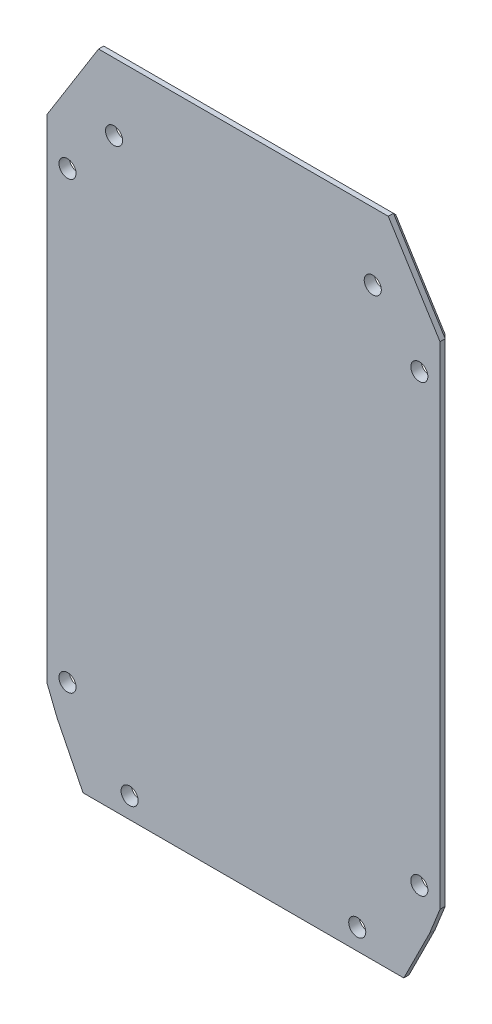
from build123d import *

# Parameters (mm, degrees)
SKETCH_3_R        = 1.65
EXTRUDE_242_DEPTH = 2
CHAMFER_C1_SIZE   = 1


with BuildPart() as part:
    # 草图3 → Extrude 242 (new body)
    with BuildSketch(Plane.XY):
        Polygon((-31, -60), (31, -60), (36, -50), (38, -45), (38, 50), (28, 66), (-28, 66), (-38, 50), (-38, -45), (-36, -50), align=None)
        with Locations((-22, -56)):
            Circle(SKETCH_3_R, mode=Mode.SUBTRACT)
        with Locations((-25, 53)):
            Circle(SKETCH_3_R, mode=Mode.SUBTRACT)
        with Locations((-34, -43)):
            Circle(SKETCH_3_R, mode=Mode.SUBTRACT)
        with Locations((-34, 43)):
            Circle(SKETCH_3_R, mode=Mode.SUBTRACT)
        with Locations((22, -56)):
            Circle(SKETCH_3_R, mode=Mode.SUBTRACT)
        with Locations((25, 53)):
            Circle(SKETCH_3_R, mode=Mode.SUBTRACT)
        with Locations((34, -43)):
            Circle(SKETCH_3_R, mode=Mode.SUBTRACT)
        with Locations((34, 43)):
            Circle(SKETCH_3_R, mode=Mode.SUBTRACT)
    extrude(amount=EXTRUDE_242_DEPTH)

    # 底盖全周向心倒角_C1
    # the kernel refuses this chamfer: 1 mm, written as the material it takes off along each edge
    with BuildSketch(Plane(origin=(-38.955099084, -42.612252289, 0), x_dir=(-0.02552928052838921, -0.010211712211355682, 0.9996219169112968), z_dir=(0.3713906763541037, -0.9284766908852594, 0)), Plane(origin=(35.044900916, -52.387747711, 0), x_dir=(0.025529280528384445, -0.010211712211353776, 0.9996219169112968), z_dir=(0.3713906763541037, 0.9284766908852594, 0))) as chamfer_c1_piece_1:
        Polygon((CHAMFER_C1_SIZE * 0.999621916911, -CHAMFER_C1_SIZE * 0.0274958766106), (-CHAMFER_C1_SIZE * 0.0274958766106, -CHAMFER_C1_SIZE * 0.999621916911), (0, 0), align=None)
    extrude(amount=10.528530783, mode=Mode.SUBTRACT)
    with BuildSketch(Plane(origin=(-38, 52.571682988, 0), x_dir=(-0.02749587661058908, 0, 0.9996219169112968), z_dir=(0, -1, 0)), Plane(origin=(38, -47.571682988, 0), x_dir=(0.02749587661058908, 0, 0.9996219169112968), z_dir=(0, 1, 0))) as chamfer_c1_piece_2:
        Polygon((CHAMFER_C1_SIZE * 0.999621916911, -CHAMFER_C1_SIZE * 0.0274958766106), (-CHAMFER_C1_SIZE * 0.0274958766106, -CHAMFER_C1_SIZE * 0.999621916911), (0, 0), align=None)
    extrude(amount=100.143365976, mode=Mode.SUBTRACT)
    with BuildSketch(Plane(origin=(-26.637010742, 68.180782812, 0), x_dir=(-0.023316456732911925, 0.014572785458069957, 0.9996219169112968), z_dir=(-0.52999894000318, -0.847998304005088, 0)), Plane(origin=(39.362989258, 47.819217188, 0), x_dir=(0.023316456732909444, 0.014572785458068402, 0.9996219169112968), z_dir=(-0.52999894000318, 0.847998304005088, 0))) as chamfer_c1_piece_3:
        Polygon((CHAMFER_C1_SIZE * 0.999621916911, -CHAMFER_C1_SIZE * 0.0274958766106), (-CHAMFER_C1_SIZE * 0.0274958766106, -CHAMFER_C1_SIZE * 0.999621916911), (0, 0), align=None)
    extrude(amount=24.01132824, mode=Mode.SUBTRACT)
    with BuildSketch(Plane(origin=(30.571682988, 66, 0), x_dir=(0, 0.027495876610582174, 0.9996219169112968), z_dir=(-1, 0, 0))) as chamfer_c1_piece_4:
        Polygon((CHAMFER_C1_SIZE * 0.999621916911, -CHAMFER_C1_SIZE * 0.0274958766106), (-CHAMFER_C1_SIZE * 0.0274958766106, -CHAMFER_C1_SIZE * 0.999621916911), (0, 0), align=None)
    extrude(amount=61.143365976, mode=Mode.SUBTRACT)
    with BuildSketch(Plane(origin=(29.849908404, -62.300183191, 0), x_dir=(0.02459305968088644, -0.01229652984044322, 0.9996219169112968), z_dir=(0.447213595499958, 0.894427190999916, 0)), Plane(origin=(-37.150091596, -47.699816809, 0), x_dir=(-0.024593059680886434, -0.012296529840443217, 0.9996219169112968), z_dir=(0.447213595499958, -0.894427190999916, 0))) as chamfer_c1_piece_5:
        Polygon((CHAMFER_C1_SIZE * 0.999621916911, -CHAMFER_C1_SIZE * 0.0274958766106), (-CHAMFER_C1_SIZE * 0.0274958766106, -CHAMFER_C1_SIZE * 0.999621916911), (0, 0), align=None)
    extrude(amount=16.323705863, mode=Mode.SUBTRACT)
    with BuildSketch(Plane(origin=(-33.571682988, -60, 0), x_dir=(0, -0.02749587661058908, 0.9996219169112968), z_dir=(1, 0, 0))) as chamfer_c1_piece_6:
        Polygon((CHAMFER_C1_SIZE * 0.999621916911, -CHAMFER_C1_SIZE * 0.0274958766106), (-CHAMFER_C1_SIZE * 0.0274958766106, -CHAMFER_C1_SIZE * 0.999621916911), (0, 0), align=None)
    extrude(amount=67.143365976, mode=Mode.SUBTRACT)


solid = part.part
